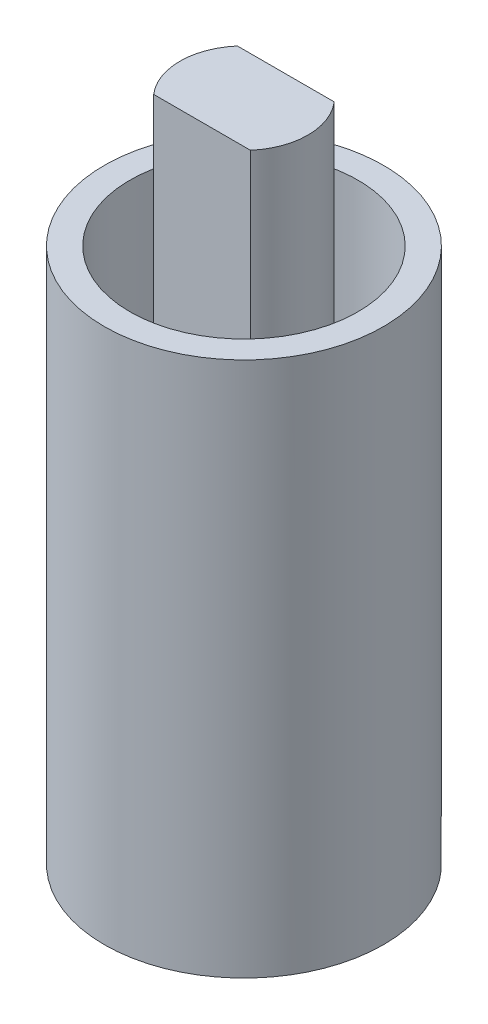
from build123d import *
from build123d.topology import SkipClean

# Parameters (mm, degrees)
SKETCH1_R           = 2.75
BOSS_EXTRUDE1_DEPTH = 1.8
BOSS_EXTRUDE2_DEPTH = 21.7
SKETCH4_R           = 6
BOSS_EXTRUDE3_DEPTH = 5
BOSS_EXTRUDE4_START = 18
SKETCH5_R           = 6
SKETCH5_R_2         = 4.9
BOSS_EXTRUDE4_DEPTH = 18


with BuildPart() as part:
    # Sketch1 → Boss-Extrude1 (new body)
    with BuildSketch(Plane(origin=(0, 0, 0), x_dir=(1, 0, 0), z_dir=(0, 1, 0))):
        Circle(SKETCH1_R)
    extrude(amount=BOSS_EXTRUDE1_DEPTH)

    # Sketch3 → Boss-Extrude2 (add)
    with SkipClean():  # the faces are left unmerged after this step: merging them gives an invalid solid
        with BuildSketch(Plane(origin=(0, 1.8, 0), x_dir=(1, 0, 0), z_dir=(0, 1, 0))):
            with BuildLine():
                Line((-2.0790623, 1.799999987), (2.0790623, 1.799999987))
                ThreePointArc((2.0790623, 1.799999987), (2.75, 0), (2.0790623, -1.799999987))
                Line((2.0790623, -1.799999987), (-2.0790623, -1.799999987))
                ThreePointArc((-2.0790623, -1.799999987), (-2.75, 0), (-2.0790623, 1.799999987))
            make_face()
        extrude(amount=BOSS_EXTRUDE2_DEPTH)

    # Sketch4 → Boss-Extrude3 (add)
    with SkipClean():  # the faces are left unmerged after this step: merging them gives an invalid solid
        with BuildSketch(Plane.XZ):
            Circle(SKETCH4_R)
        extrude(amount=BOSS_EXTRUDE3_DEPTH)

    # Sketch5 → Boss-Extrude4 (add)
    with SkipClean():  # the faces are left unmerged after this step: merging them gives an invalid solid
        with BuildSketch(Plane(origin=(0, 0, 0), x_dir=(1, 0, 0), z_dir=(0, 1, 0)).offset(BOSS_EXTRUDE4_START)):
            Circle(SKETCH5_R)
            Circle(SKETCH5_R_2, mode=Mode.SUBTRACT)
        extrude(amount=-BOSS_EXTRUDE4_DEPTH)


solid = part.part
